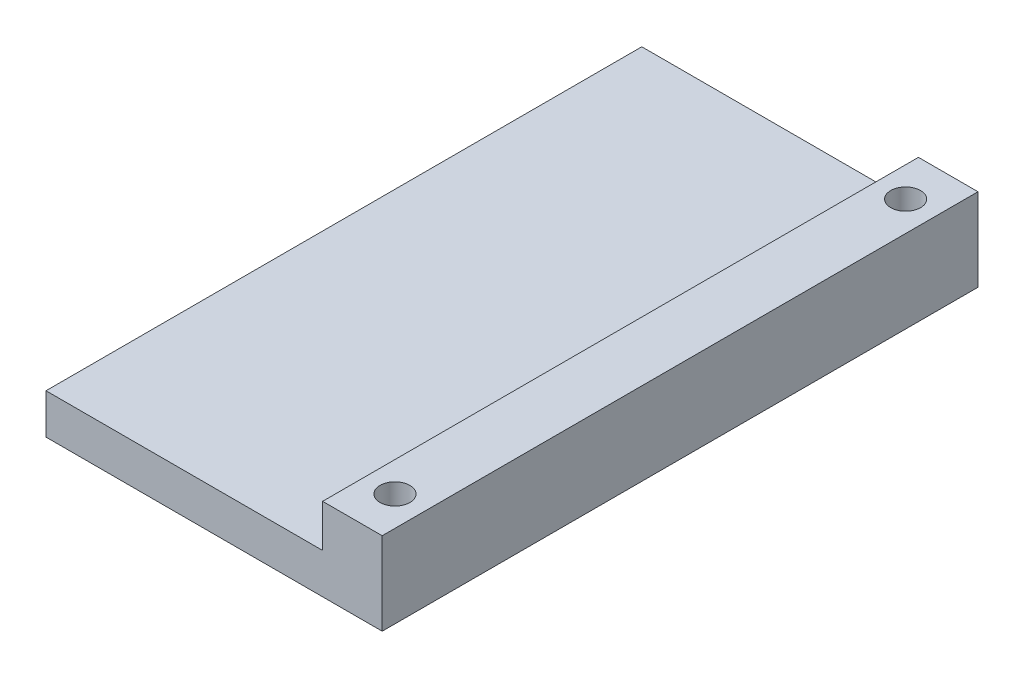
from build123d import *

# Parameters (mm, degrees)
SKETCH1_W               = 41.275
SKETCH1_H               = 88.9
BOSS_EXTRUDE1_DEPTH     = 5.9944
SKETCH1_5_W             = 8.89
SKETCH1_5_H             = 88.9
BOSS_EXTRUDE2_DEPTH     = 12.3444
CUT_EXTRUDE1_DEPTH      = 103.820821998
CUT_EXTRUDE1_DEPTH_BACK = 103.820821998
SKETCH3_R               = 2.2225


with BuildPart() as part:
    # Sketch1 → Boss-Extrude1 (new body)
    with BuildSketch(Plane(origin=(0, 0, 0), x_dir=(1, 0, 0), z_dir=(0, 1, 0))):
        with Locations((20.6375, 44.45)):
            Rectangle(SKETCH1_W, SKETCH1_H)
    extrude(amount=BOSS_EXTRUDE1_DEPTH)

    # Sketch1<5> → Boss-Extrude2 (add)
    with BuildSketch(Plane(origin=(0, 0, 0), x_dir=(1, 0, 0), z_dir=(0, 1, 0))):
        with Locations((45.72, 44.45)):
            Rectangle(SKETCH1_5_W, SKETCH1_5_H)
    extrude(amount=BOSS_EXTRUDE2_DEPTH)

    # Sketch3 → Cut-Extrude1 (cut, two sides: drawn at the far end of the back side and taken through both)
    with BuildSketch(Plane(origin=(0, 12.3444, 0), x_dir=(1, 0, 0), z_dir=(0, 1, 0)).offset(-CUT_EXTRUDE1_DEPTH_BACK)):
        with Locations((45.72, 82.55)):
            Circle(SKETCH3_R)
        with Locations((45.72, 6.35)):
            Circle(SKETCH3_R)
    extrude(amount=CUT_EXTRUDE1_DEPTH + CUT_EXTRUDE1_DEPTH_BACK, mode=Mode.SUBTRACT)


solid = part.part
